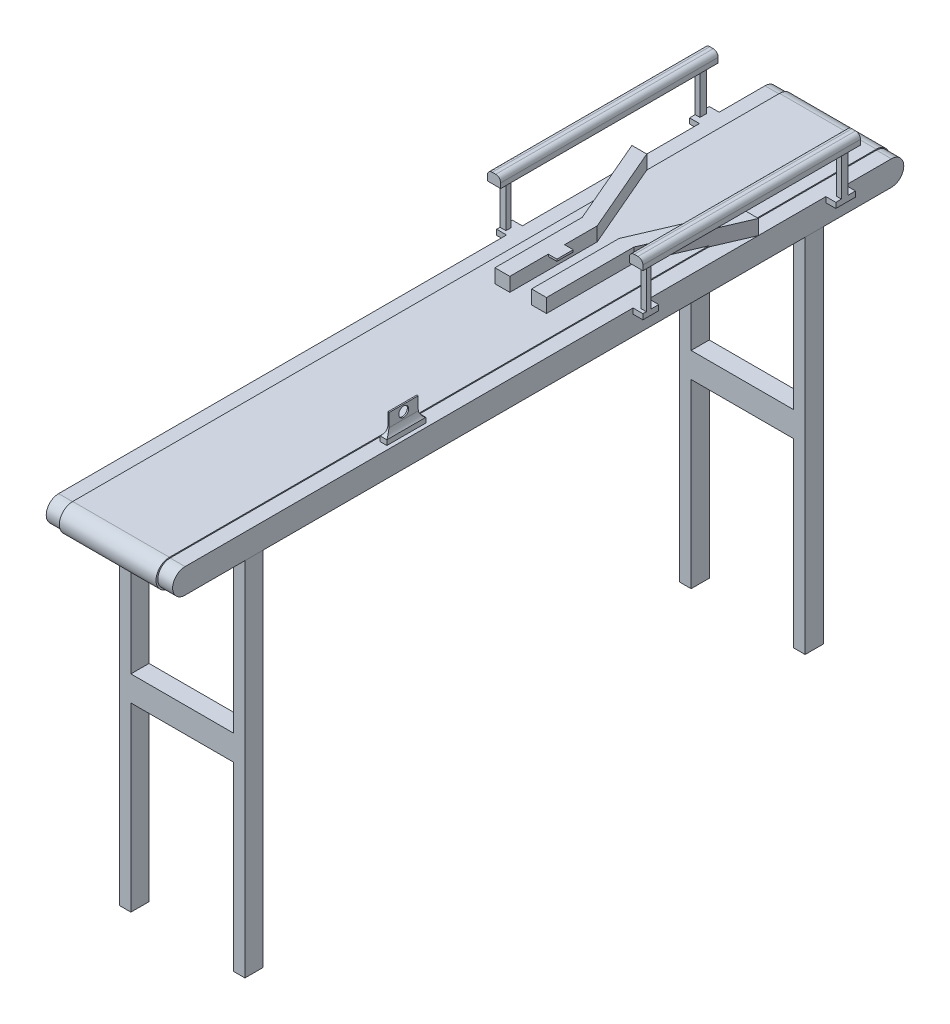
from build123d import *

# Parameters (mm, degrees)
CROQUIS1_W                   = 255
CROQUIS1_H                   = 1475
SALIENTE_EXTRUIR1_DEPTH      = 50
CORTAR_EXTRUIR1_DEPTH        = 1498.714926146
SALIENTE_EXTRUIR2_START      = -30
SALIENTE_EXTRUIR2_DEPTH      = 195
CROQUIS6_W                   = 23.089927544
CROQUIS6_H                   = 36.579574148
SALIENTE_EXTRUIR3_DEPTH      = 731
SALIENTE_EXTRUIR4_REACH      = 1668.675
CROQUIS7_W                   = 36.579574148
CROQUIS7_H                   = 50.716877677
SALIENTE_EXTRUIR5_DEPTH      = 20
SALIENTE_EXTRUIR5_DEPTH_BACK = 275
CROQUIS9_W                   = 39.769947059
CROQUIS9_H                   = 10.786278749
CROQUIS9_W_2                 = 31.799661674
CROQUIS10_W                  = 9.640500607
CROQUIS10_H                  = 13.128056889
CROQUIS10_W_2                = 10.31069774
CROQUIS10_W_3                = 11.904259836
CROQUIS10_H_2                = 10.427339656
CROQUIS10_H_3                = 9.058106281
SALIENTE_EXTRUIR6_DEPTH      = 85
CROQUIS11_W                  = 27.062582302
CROQUIS11_H                  = 438.810649055
CROQUIS11_W_2                = 27.39424904
SALIENTE_EXTRUIR7_DEPTH      = 20
REDONDEO1_R                  = 10
SALIENTE_EXTRUIR8_DEPTH      = 30
CROQUIS13_W                  = 30
CROQUIS13_H                  = 176.208611665
SALIENTE_EXTRUIR9_DEPTH      = 30
CROQUIS14_W                  = 17.440501772
CROQUIS14_H                  = 32.827990866
SALIENTE_EXTRUIR10_DEPTH     = 4
CROQUIS15_W                  = 88.168794784
CROQUIS15_H                  = 128.918218337
SALIENTE_EXTRUIR11_DEPTH     = 10
CROQUIS16_R                  = 2.5
CROQUIS16_W                  = 10.651190854
CROQUIS16_H                  = 24.522509177
SALIENTE_EXTRUIR12_DEPTH     = 5
CROQUIS17_W                  = 58.168794784
CROQUIS17_H                  = 13.953634649
SALIENTE_EXTRUIR13_DEPTH     = 2
CROQUIS18_W                  = 58.168794784
CROQUIS18_H                  = 2
SALIENTE_EXTRUIR14_DEPTH     = 40
CROQUIS19_W                  = 13.463338372
CROQUIS19_H                  = 78.536140501
SALIENTE_EXTRUIR15_DEPTH     = 10
CROQUIS20_W                  = 2.68
CROQUIS20_H                  = 58.586886377
SALIENTE_EXTRUIR16_DEPTH     = 40
REDONDEO2_R                  = 20
CROQUIS21_R                  = 10
CORTAR_EXTRUIR2_DEPTH        = 40


with BuildPart() as part:
    # Croquis1 → Saliente-Extruir1 (new body)
    with BuildSketch(Plane(origin=(0, 0, 0), x_dir=(1, 0, 0), z_dir=(0, 1, 0))):
        with Locations((-127.5, 737.5)):
            Rectangle(CROQUIS1_W, CROQUIS1_H)
    extrude(amount=SALIENTE_EXTRUIR1_DEPTH)

    # Croquis2 → Cortar-Extruir1 (cut, through all)
    with BuildSketch(Plane.ZY.offset(255)):
        with BuildLine():
            Line((6.458362323, -12.380571648), (-25, 0))
            ThreePointArc((-25, 0), (0, 25), (-25, 50))
            Line((-25, 50), (5.438958409, 62.035914062))
            Line((5.438958409, 62.035914062), (6.458362323, -12.380571648))
        make_face()
        with BuildLine():
            Line((-1481.23440759, 62.380571648), (-1449.776045267, 50))
            ThreePointArc((-1449.776045267, 50), (-1474.776045267, 25), (-1449.776045267, 0))
            Line((-1449.776045267, 0), (-1480.215003676, -12.035914062))
            Line((-1480.215003676, -12.035914062), (-1481.23440759, 62.380571648))
        make_face()
    extrude(amount=-CORTAR_EXTRUIR1_DEPTH, mode=Mode.SUBTRACT)

    # Croquis5 → Saliente-Extruir2 (add)
    with BuildSketch(Plane.ZY.offset(255).offset(SALIENTE_EXTRUIR2_START)):
        with BuildLine():
            Line((-1449.276045267, 52), (-23.5, 52))
            ThreePointArc((-23.5, 52), (3.5, 25), (-23.5, -2))
            Line((-23.5, -2), (-1449.276045267, -2))
            ThreePointArc((-1449.276045267, -2), (-1476.276045267, 25), (-1449.276045267, 52))
        make_face()
    extrude(amount=-SALIENTE_EXTRUIR2_DEPTH)

    # Croquis6 → Saliente-Extruir3 (add)
    with BuildSketch(Plane.XZ):
        with Locations((-243.455036228, -166.019692376)):
            Rectangle(CROQUIS6_W, CROQUIS6_H)
        with Locations((-13.455036228, -166.019692376)):
            Rectangle(CROQUIS6_W, CROQUIS6_H)
        with Locations((-13.455036228, -1296.019692376)):
            Rectangle(CROQUIS6_W, CROQUIS6_H)
        with Locations((-243.455036228, -1296.019692376)):
            Rectangle(CROQUIS6_W, CROQUIS6_H)
    extrude(amount=SALIENTE_EXTRUIR3_DEPTH)

    # Croquis7 → Saliente-Extruir4 (add, up to next)
    with BuildSketch(Plane(origin=(-1.910072456, 0, 0), x_dir=(0, 0, -1), z_dir=(1, 0, 0)), mode=Mode.PRIVATE) as saliente_extruir4_sk1:
        with Locations((166.019692376, -340.141561162)):
            Rectangle(CROQUIS7_W, CROQUIS7_H)
    saliente_extruir4_tool1 = extrude(saliente_extruir4_sk1.sketch, amount=-SALIENTE_EXTRUIR4_REACH, mode=Mode.PRIVATE) - part.part
    # Croquis7 → Saliente-Extruir4 (add, up to next)
    with BuildSketch(Plane(origin=(-1.910072456, 0, 0), x_dir=(0, 0, -1), z_dir=(1, 0, 0)), mode=Mode.PRIVATE) as saliente_extruir4_sk2:
        with Locations((1296.019692376, -340.141561162)):
            Rectangle(CROQUIS7_W, CROQUIS7_H)
    saliente_extruir4_tool2 = extrude(saliente_extruir4_sk2.sketch, amount=-SALIENTE_EXTRUIR4_REACH, mode=Mode.PRIVATE) - part.part
    add(saliente_extruir4_tool1.solids().sort_by_distance((-1.910072, -340.141561, -166.019692))[0])
    add(saliente_extruir4_tool2.solids().sort_by_distance((-1.910072, -340.141561, -1296.019692))[0])

    # Croquis9 → Saliente-Extruir5 (add, two sides: drawn at the far end of the back side and taken through both)
    with BuildSketch(Plane.ZY.offset(255).offset(-SALIENTE_EXTRUIR5_DEPTH_BACK)):
        with Locations((-1337.547382333, 44.606860626)):
            Rectangle(CROQUIS9_W, CROQUIS9_H)
        with Locations((-944.49167922, 44.606860626)):
            Rectangle(CROQUIS9_W_2, CROQUIS9_H)
    extrude(amount=SALIENTE_EXTRUIR5_DEPTH + SALIENTE_EXTRUIR5_DEPTH_BACK)

    # Croquis10 → Saliente-Extruir6 (add)
    with BuildSketch(Plane(origin=(0, 50, 0), x_dir=(1, 0, 0), z_dir=(0, 1, 0))):
        with Locations((-270.179749697, 1335.537426787)):
            Rectangle(CROQUIS10_W, CROQUIS10_H)
        with Locations((14.84465113, 1335.537426787)):
            Rectangle(CROQUIS10_W_2, CROQUIS10_H)
        with Locations((-269.047870082, 940.647242767)):
            Rectangle(CROQUIS10_W_3, CROQUIS10_H_2)
        with Locations((14.84465113, 939.96262608)):
            Rectangle(CROQUIS10_W_2, CROQUIS10_H_3)
    extrude(amount=SALIENTE_EXTRUIR6_DEPTH)

    # Croquis11 → Saliente-Extruir7 (add)
    with BuildSketch(Plane(origin=(0, 135, 0), x_dir=(1, 0, 0), z_dir=(0, 1, 0))):
        with Locations((-270.45368875, 1138.027031334)):
            Rectangle(CROQUIS11_W, CROQUIS11_H)
        with Locations((16.285457001, 1138.027031334)):
            Rectangle(CROQUIS11_W_2, CROQUIS11_H)
    extrude(amount=SALIENTE_EXTRUIR7_DEPTH)

    # Redondeo1
    redondeo1_edges = [part.edges().sort_by_distance(p)[0] for p in [
        (-283.984979901, 155, -1138.027031335),
        (-256.922397599, 155, -1138.027031335),
        (29.982581521, 155, -1138.027031335),
        (2.588332481, 155, -1138.027031335),
    ]]
    fillet(redondeo1_edges, radius=REDONDEO1_R)

    # Croquis12 → Saliente-Extruir8 (add)
    with BuildSketch(Plane(origin=(0, 50, 0), x_dir=(1, 0, 0), z_dir=(0, 1, 0))):
        Polygon((-225, 1181.407477402), (-149.5, 1005.791328584), (-179.5, 1005.791328584), (-255, 1181.407477402), align=None)
        Polygon((-105.5, 1005.791328584), (-75.5, 1005.791328584), (0, 1181.407477402), (-30, 1181.407477402), align=None)
    extrude(amount=SALIENTE_EXTRUIR8_DEPTH)

    # Croquis13 → Saliente-Extruir9 (add)
    with BuildSketch(Plane(origin=(0, 50, 0), x_dir=(1, 0, 0), z_dir=(0, 1, 0))):
        with Locations((-164.5, 917.687022752)):
            Rectangle(CROQUIS13_W, CROQUIS13_H)
        with Locations((-90.5, 917.687022752)):
            Rectangle(CROQUIS13_W, CROQUIS13_H)
    extrude(amount=SALIENTE_EXTRUIR9_DEPTH)

    # Croquis14 → Saliente-Extruir10 (add)
    with BuildSketch(Plane(origin=(0, 80, 0), x_dir=(1, 0, 0), z_dir=(0, 1, 0))):
        with Locations((-140.779749114, 923.592229043)):
            Rectangle(CROQUIS14_W, CROQUIS14_H)
    extrude(amount=-SALIENTE_EXTRUIR10_DEPTH)

    # Croquis15 → Saliente-Extruir11 (add)
    with BuildSketch(Plane.ZY.offset(255)):
        with Locations((-191.814302694, -50.562306629)):
            Rectangle(CROQUIS15_W, CROQUIS15_H)
    extrude(amount=SALIENTE_EXTRUIR11_DEPTH)

    # Croquis16 → Saliente-Extruir12 (add)
    with BuildSketch(Plane.ZY.offset(265)):
        with Locations((-191.814302694, -27.70098442)):
            Circle(CROQUIS16_R)
        with Locations((-191.814302694, -84.548619331)):
            Rectangle(CROQUIS16_W, CROQUIS16_H)
    extrude(amount=SALIENTE_EXTRUIR12_DEPTH)

    # Croquis17 → Saliente-Extruir13 (add)
    with BuildSketch(Plane.ZY.offset(265)):
        with Locations((-191.814302694, -40.880014785)):
            Rectangle(CROQUIS17_W, CROQUIS17_H)
    extrude(amount=SALIENTE_EXTRUIR13_DEPTH)

    # Croquis18 → Saliente-Extruir14 (add)
    with BuildSketch(Plane.ZY.offset(267)):
        with Locations((-191.814302694, -34.90319746)):
            Rectangle(CROQUIS18_W, CROQUIS18_H)
    extrude(amount=SALIENTE_EXTRUIR14_DEPTH)

    # Croquis19 → Saliente-Extruir15 (add)
    with BuildSketch(Plane(origin=(0, 50, 0), x_dir=(1, 0, 0), z_dir=(0, 1, 0))):
        with Locations((-14.611942022, 479.357079374)):
            Rectangle(CROQUIS19_W, CROQUIS19_H)
    extrude(amount=SALIENTE_EXTRUIR15_DEPTH)

    # Croquis20 → Saliente-Extruir16 (add)
    with BuildSketch(Plane(origin=(0, 60, 0), x_dir=(1, 0, 0), z_dir=(0, 1, 0))):
        with Locations((-14.611942022, 479.357079374)):
            Rectangle(CROQUIS20_W, CROQUIS20_H)
    extrude(amount=SALIENTE_EXTRUIR16_DEPTH)

    # Redondeo2
    # the kernel refuses this fillet: 20 mm, written as the material it adds along each edge
    with BuildSketch(Plane(origin=(-15.951942022, 60, -508.650522562), x_dir=(-1, 0, 0), z_dir=(0, 0, 1)), Plane(origin=(-13.271942022, 60, -450.063636185), x_dir=(1, 0, 0), z_dir=(0, 0, -1))) as redondeo2_piece_1:
        with BuildLine():
            CenterArc((20, -13.660039196), REDONDEO2_R, 136.921325504, 43.078674496)
            Line((0, -13.660039196), (-0.4, -13.660039196))
            Line((-0.4, -13.660039196), (-0.4, 0))
            Line((-0.4, 0), (0, 0.4))
            ThreePointArc((0, 0.4), (2.695834593, 0.4), (5.09950257, 0.273200784))
            Line((5.09950257, 0.273200784), (5.391669186, 0))
        make_face()
    extrude(amount=58.586886377)
    with BuildSketch(Plane(origin=(-15.951942022, 60, -450.063636185), x_dir=(0, 0, 1), z_dir=(1, 0, 0)), Plane(origin=(-13.271942022, 60, -508.650522562), x_dir=(0, 0, -1), z_dir=(-1, 0, 0))) as redondeo2_piece_2:
        with BuildLine():
            CenterArc((20, -17.305834203), REDONDEO2_R, 120.083968557, 59.916031444)
            Line((0, -17.305834203), (-0.4, -17.305834203))
            Line((-0.4, -17.305834203), (-0.4, 0))
            Line((-0.4, 0), (0, 0.4))
            ThreePointArc((0, 0.4), (4.987313531, 0.4), (9.774119603, 0.346116684))
            Line((9.774119603, 0.346116684), (9.974627062, 0))
        make_face()
    extrude(amount=2.68)
    with BuildSketch(Plane(origin=(-15.951942022, 60, -542.800620551), x_dir=(-1, 0, 0), z_dir=(0, 0, 1))) as redondeo2_piece_3a_section:
        with BuildLine():
            CenterArc((20, -13.660039196), REDONDEO2_R, 136.921325504, 43.078674496)
            Line((0, -13.660039196), (-0.4, -13.660039196))
            Line((-0.4, -13.660039196), (-0.4, 0))
            Line((-0.4, 0), (0, 0.4))
            ThreePointArc((0, 0.4), (2.695834593, 0.4), (5.09950257, 0.273200784))
            Line((5.09950257, 0.273200784), (5.391669186, 0))
        make_face()
    redondeo2_piece_3a = extrude(amount=92.736984365, mode=Mode.PRIVATE)
    redondeo2_piece_3a = split(redondeo2_piece_3a, bisect_by=Plane(origin=(-17.26064634, 63.707255997, -518.625149624), z_dir=(0, 0, 1)), keep=Keep.TOP, mode=Mode.PRIVATE)
    redondeo2_piece_3a = split(redondeo2_piece_3a, bisect_by=Plane(origin=(-17.26064634, 63.707255997, -508.650522562), z_dir=(0, 0, -1)), keep=Keep.TOP, mode=Mode.PRIVATE)
    with BuildSketch(Plane(origin=(-13.271942022, 60, -508.650522562), x_dir=(0, 0, -1), z_dir=(-1, 0, 0))) as redondeo2_piece_3b_section:
        with BuildLine():
            CenterArc((20, -17.305834203), REDONDEO2_R, 120.083968557, 59.916031444)
            Line((0, -17.305834203), (-0.4, -17.305834203))
            Line((-0.4, -17.305834203), (-0.4, 0))
            Line((-0.4, 0), (0, 0.4))
            ThreePointArc((0, 0.4), (4.987313531, 0.4), (9.774119603, 0.346116684))
            Line((9.774119603, 0.346116684), (9.974627062, 0))
        make_face()
    redondeo2_piece_3b = extrude(amount=45.944585507, mode=Mode.PRIVATE)
    redondeo2_piece_3b = split(redondeo2_piece_3b, bisect_by=Plane(origin=(-21.343611208, 64.324037821, -511.234139975), z_dir=(1, 0, 0)), keep=Keep.TOP, mode=Mode.PRIVATE)
    redondeo2_piece_3b = split(redondeo2_piece_3b, bisect_by=Plane(origin=(-15.951942022, 64.324037821, -511.234139975), z_dir=(-1, 0, 0)), keep=Keep.TOP, mode=Mode.PRIVATE)
    redondeo2_piece_3 = redondeo2_piece_3a & redondeo2_piece_3b
    add(redondeo2_piece_3)
    with BuildSketch(Plane(origin=(-15.951942022, 60, -508.650522562), x_dir=(-1, 0, 0), z_dir=(0, 0, 1))) as redondeo2_piece_4a_section:
        with BuildLine():
            CenterArc((20, -13.660039196), REDONDEO2_R, 136.921325504, 43.078674496)
            Line((0, -13.660039196), (-0.4, -13.660039196))
            Line((-0.4, -13.660039196), (-0.4, 0))
            Line((-0.4, 0), (0, 0.4))
            ThreePointArc((0, 0.4), (2.695834593, 0.4), (5.09950257, 0.273200784))
            Line((5.09950257, 0.273200784), (5.391669186, 0))
        make_face()
    redondeo2_piece_4a = extrude(amount=92.736984365, mode=Mode.PRIVATE)
    redondeo2_piece_4a = split(redondeo2_piece_4a, bisect_by=Plane(origin=(-17.26064634, 63.707255997, -440.089009123), z_dir=(0, 0, -1)), keep=Keep.TOP, mode=Mode.PRIVATE)
    redondeo2_piece_4a = split(redondeo2_piece_4a, bisect_by=Plane(origin=(-17.26064634, 63.707255997, -450.063636185), z_dir=(0, 0, 1)), keep=Keep.TOP, mode=Mode.PRIVATE)
    with BuildSketch(Plane(origin=(-59.216527529, 60, -450.063636185), x_dir=(0, 0, 1), z_dir=(1, 0, 0))) as redondeo2_piece_4b_section:
        with BuildLine():
            CenterArc((20, -17.305834203), REDONDEO2_R, 120.083968557, 59.916031444)
            Line((0, -17.305834203), (-0.4, -17.305834203))
            Line((-0.4, -17.305834203), (-0.4, 0))
            Line((-0.4, 0), (0, 0.4))
            ThreePointArc((0, 0.4), (4.987313531, 0.4), (9.774119603, 0.346116684))
            Line((9.774119603, 0.346116684), (9.974627062, 0))
        make_face()
    redondeo2_piece_4b = extrude(amount=45.944585507, mode=Mode.PRIVATE)
    redondeo2_piece_4b = split(redondeo2_piece_4b, bisect_by=Plane(origin=(-21.343611208, 64.324037821, -447.480018772), z_dir=(1, 0, 0)), keep=Keep.TOP, mode=Mode.PRIVATE)
    redondeo2_piece_4b = split(redondeo2_piece_4b, bisect_by=Plane(origin=(-15.951942022, 64.324037821, -447.480018772), z_dir=(-1, 0, 0)), keep=Keep.TOP, mode=Mode.PRIVATE)
    redondeo2_piece_4 = redondeo2_piece_4a & redondeo2_piece_4b
    add(redondeo2_piece_4)
    with BuildSketch(Plane(origin=(-13.271942022, 60, -415.913538197), x_dir=(1, 0, 0), z_dir=(0, 0, -1))) as redondeo2_piece_5a_section:
        with BuildLine():
            CenterArc((20, -13.660039196), REDONDEO2_R, 136.921325504, 43.078674496)
            Line((0, -13.660039196), (-0.4, -13.660039196))
            Line((-0.4, -13.660039196), (-0.4, 0))
            Line((-0.4, 0), (0, 0.4))
            ThreePointArc((0, 0.4), (2.695834593, 0.4), (5.09950257, 0.273200784))
            Line((5.09950257, 0.273200784), (5.391669186, 0))
        make_face()
    redondeo2_piece_5a = extrude(amount=92.736984365, mode=Mode.PRIVATE)
    redondeo2_piece_5a = split(redondeo2_piece_5a, bisect_by=Plane(origin=(-11.963237704, 63.707255997, -440.089009123), z_dir=(0, 0, -1)), keep=Keep.TOP, mode=Mode.PRIVATE)
    redondeo2_piece_5a = split(redondeo2_piece_5a, bisect_by=Plane(origin=(-11.963237704, 63.707255997, -450.063636185), z_dir=(0, 0, 1)), keep=Keep.TOP, mode=Mode.PRIVATE)
    with BuildSketch(Plane(origin=(-15.951942022, 60, -450.063636185), x_dir=(0, 0, 1), z_dir=(1, 0, 0))) as redondeo2_piece_5b_section:
        with BuildLine():
            CenterArc((20, -17.305834203), REDONDEO2_R, 120.083968557, 59.916031444)
            Line((0, -17.305834203), (-0.4, -17.305834203))
            Line((-0.4, -17.305834203), (-0.4, 0))
            Line((-0.4, 0), (0, 0.4))
            ThreePointArc((0, 0.4), (4.987313531, 0.4), (9.774119603, 0.346116684))
            Line((9.774119603, 0.346116684), (9.974627062, 0))
        make_face()
    redondeo2_piece_5b = extrude(amount=45.944585507, mode=Mode.PRIVATE)
    redondeo2_piece_5b = split(redondeo2_piece_5b, bisect_by=Plane(origin=(-7.880272836, 64.324037821, -447.480018772), z_dir=(-1, 0, 0)), keep=Keep.TOP, mode=Mode.PRIVATE)
    redondeo2_piece_5b = split(redondeo2_piece_5b, bisect_by=Plane(origin=(-13.271942022, 64.324037821, -447.480018772), z_dir=(1, 0, 0)), keep=Keep.TOP, mode=Mode.PRIVATE)
    redondeo2_piece_5 = redondeo2_piece_5a & redondeo2_piece_5b
    add(redondeo2_piece_5)
    with BuildSketch(Plane(origin=(29.992643485, 60, -508.650522562), x_dir=(0, 0, -1), z_dir=(-1, 0, 0))) as redondeo2_piece_6a_section:
        with BuildLine():
            CenterArc((20, -17.305834203), REDONDEO2_R, 120.083968557, 59.916031444)
            Line((0, -17.305834203), (-0.4, -17.305834203))
            Line((-0.4, -17.305834203), (-0.4, 0))
            Line((-0.4, 0), (0, 0.4))
            ThreePointArc((0, 0.4), (4.987313531, 0.4), (9.774119603, 0.346116684))
            Line((9.774119603, 0.346116684), (9.974627062, 0))
        make_face()
    redondeo2_piece_6a = extrude(amount=45.944585507, mode=Mode.PRIVATE)
    redondeo2_piece_6a = split(redondeo2_piece_6a, bisect_by=Plane(origin=(-7.880272836, 64.324037821, -511.234139975), z_dir=(-1, 0, 0)), keep=Keep.TOP, mode=Mode.PRIVATE)
    redondeo2_piece_6a = split(redondeo2_piece_6a, bisect_by=Plane(origin=(-13.271942022, 64.324037821, -511.234139975), z_dir=(1, 0, 0)), keep=Keep.TOP, mode=Mode.PRIVATE)
    with BuildSketch(Plane(origin=(-13.271942022, 60, -450.063636185), x_dir=(1, 0, 0), z_dir=(0, 0, -1))) as redondeo2_piece_6b_section:
        with BuildLine():
            CenterArc((20, -13.660039196), REDONDEO2_R, 136.921325504, 43.078674496)
            Line((0, -13.660039196), (-0.4, -13.660039196))
            Line((-0.4, -13.660039196), (-0.4, 0))
            Line((-0.4, 0), (0, 0.4))
            ThreePointArc((0, 0.4), (2.695834593, 0.4), (5.09950257, 0.273200784))
            Line((5.09950257, 0.273200784), (5.391669186, 0))
        make_face()
    redondeo2_piece_6b = extrude(amount=92.736984365, mode=Mode.PRIVATE)
    redondeo2_piece_6b = split(redondeo2_piece_6b, bisect_by=Plane(origin=(-11.963237704, 63.707255997, -518.625149624), z_dir=(0, 0, 1)), keep=Keep.TOP, mode=Mode.PRIVATE)
    redondeo2_piece_6b = split(redondeo2_piece_6b, bisect_by=Plane(origin=(-11.963237704, 63.707255997, -508.650522562), z_dir=(0, 0, -1)), keep=Keep.TOP, mode=Mode.PRIVATE)
    redondeo2_piece_6 = redondeo2_piece_6a & redondeo2_piece_6b
    add(redondeo2_piece_6)

    # Croquis21 → Cortar-Extruir2 (cut)
    with BuildSketch(Plane(origin=(-13.271942022, 0, 0), x_dir=(0, 0, -1), z_dir=(1, 0, 0))):
        with Locations((479.357079374, 86.84464624)):
            Circle(CROQUIS21_R)
    extrude(amount=-CORTAR_EXTRUIR2_DEPTH, mode=Mode.SUBTRACT)


solid = part.part
